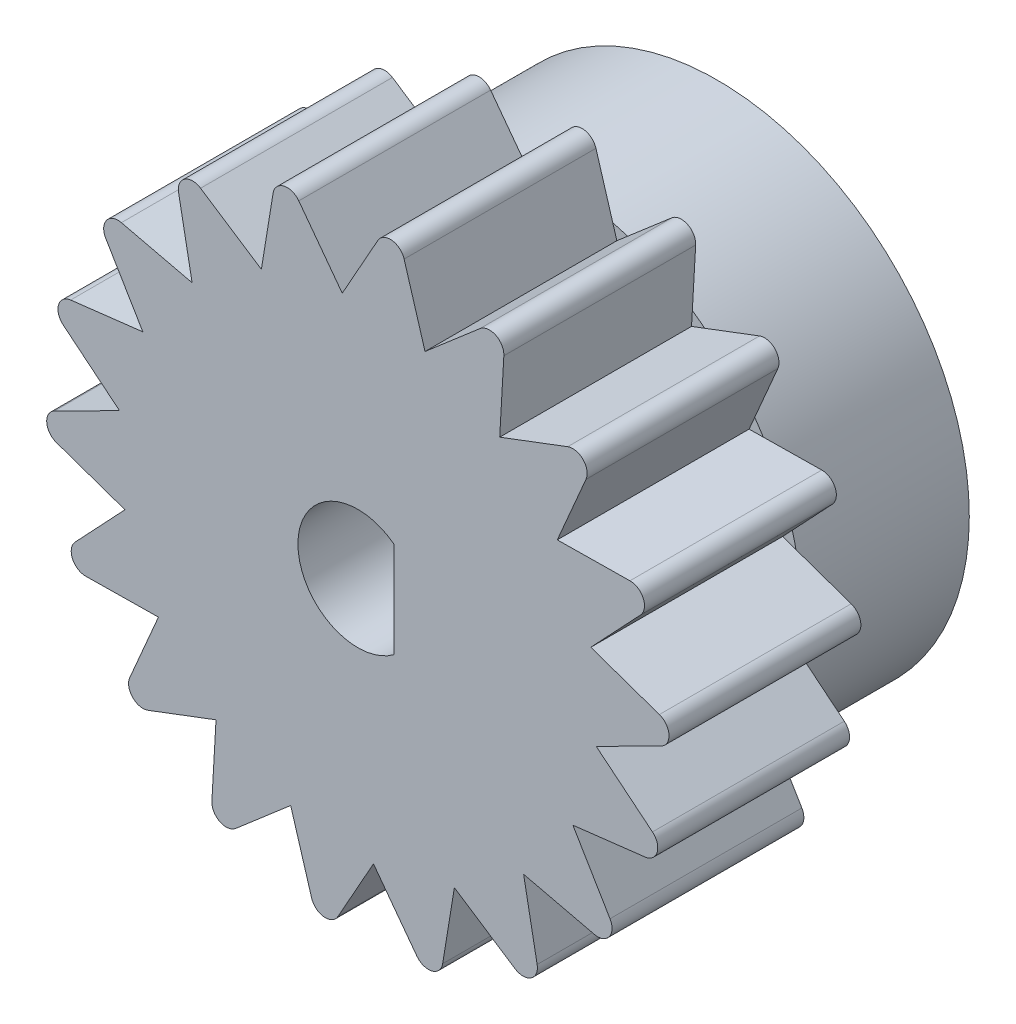
from build123d import *

# Parameters (mm, degrees)
SKETCH1_R                 = 7.5
BOSS_EXTRUDE1_DEPTH       = 10
SKETCH3_R                 = 10.5
BOSS_EXTRUDE2_DEPTH       = 5
CUT_EXTRUDE1_REACH        = 23.107
BOSS_EXTRUDE3_START       = -8
SKETCH4_R                 = 14.5
SKETCH4_R_2               = 7.5
BOSS_EXTRUDE3_DEPTH       = 8
BOSS_EXTRUDE4_OUTLINE_R   = 10.5
BOSS_EXTRUDE4_OUTLINE_R_2 = 7.5
BOSS_EXTRUDE4_DEPTH       = 2
SKETCH6_R                 = 14.465552515
CUT_EXTRUDE2_DEPTH        = 8


# Read off the part's stored shape, not the designer's step: Boss-Extrude4
with BuildPart() as part:
    # Sketch1 → Boss-Extrude1 (new body)
    with BuildSketch(Plane.XY):
        Circle(SKETCH1_R)
    extrude(amount=BOSS_EXTRUDE1_DEPTH)

    # Sketch3 → Boss-Extrude2 (add)
    with BuildSketch(Plane(origin=(0, 0, 0), x_dir=(-1, 0, 0), z_dir=(0, 0, -1))):
        Circle(SKETCH3_R)
    extrude(amount=BOSS_EXTRUDE2_DEPTH)

    # Sketch2 → Cut-Extrude1 (cut, up to next)
    with BuildSketch(Plane.XY.offset(10), mode=Mode.PRIVATE) as cut_extrude1_sk1:
        with BuildLine():
            Line((1.5, 2), (1.5, -2))
            ThreePointArc((1.5, -2), (-2.5, 0), (1.5, 2))
        make_face()
    cut_extrude1_tool1 = extrude(cut_extrude1_sk1.sketch, amount=-CUT_EXTRUDE1_REACH, mode=Mode.PRIVATE) & part.part
    add(cut_extrude1_tool1.solids().sort_by_distance((-0.316718, 0, 10))[0], mode=Mode.SUBTRACT)

    # Sketch4 → Boss-Extrude3 (add)
    with BuildSketch(Plane.XY.offset(10).offset(BOSS_EXTRUDE3_START)):
        Circle(SKETCH4_R)
        with Locations(Location((0, 0, 0), (0, 0, 180))):
            Circle(SKETCH4_R_2, mode=Mode.SUBTRACT)
    extrude(amount=BOSS_EXTRUDE3_DEPTH)

    # Boss-Extrude4 outline → Boss-Extrude4 (add)
    with BuildSketch(Plane.XY):
        Circle(BOSS_EXTRUDE4_OUTLINE_R)
        Circle(BOSS_EXTRUDE4_OUTLINE_R_2, mode=Mode.SUBTRACT)
    extrude(amount=BOSS_EXTRUDE4_DEPTH)

    # Sketch6 → Cut-Extrude2 (cut)
    with BuildSketch(Plane.XY.offset(10)):
        Circle(SKETCH6_R)
        with BuildLine():
            Line((5.915587052, 8.062619291), (6.088339002, 11.088366247))
            ThreePointArc((6.088339002, 11.088366247), (5.754853945, 11.660608595), (5.097799094, 11.57722688))
            Line((5.097799094, 11.57722688), (2.801255295, 9.599633783))
            Line((2.801255295, 9.599633783), (1.92872262, 12.501990517))
            ThreePointArc((1.92872262, 12.501990517), (1.419630763, 12.925663822), (0.830719394, 12.622584645))
            Line((0.830719394, 12.622584645), (-0.650949193, 9.978790766))
            Line((-0.650949193, 9.978790766), (-2.463526175, 12.407690221))
            ThreePointArc((-2.463526175, 12.407690221), (-3.086820841, 12.631693229), (-3.536557325, 12.145472413))
            Line((-3.536557325, 12.145472413), (-4.024639601, 9.154358311))
            Line((-4.024639601, 9.154358311), (-6.558637356, 10.816839366))
            ThreePointArc((-6.558637356, 10.816839366), (-7.220956294, 10.814154009), (-7.477273036, 10.203436959))
            Line((-7.477273036, 10.203436959), (-6.912899076, 7.225775139))
            Line((-6.912899076, 7.225775139), (-9.862680076, 7.921318044))
            ThreePointArc((-9.862680076, 7.921318044), (-10.484137849, 7.692268216), (-10.516119267, 7.030716422))
            Line((-10.516119267, 7.030716422), (-8.967360899, 4.425656845))
            Line((-8.967360899, 4.425656845), (-11.977138021, 4.07036886))
            ThreePointArc((-11.977138021, 4.07036886), (-12.48277765, 3.64258135), (-12.286566313, 3.009987721))
            Line((-12.286566313, 3.009987721), (-9.940226653, 1.09173902))
            Line((-9.940226653, 1.09173902), (-12.646976358, -0.271526881))
            ThreePointArc((-12.646976358, -0.271526881), (-12.97581024, -0.846454586), (-12.575072131, -1.373789921))
            Line((-12.575072131, -1.373789921), (-9.714154371, -2.373858644))
            Line((-9.714154371, -2.373858644), (-11.791402696, -4.580672473))
            ThreePointArc((-11.791402696, -4.580672473), (-11.903768612, -5.233395606), (-11.346838661, -5.591868224))
            Line((-11.346838661, -5.591868224), (-8.316411706, -5.553133921))
            Line((-8.316411706, -5.553133921), (-9.513611846, -8.337321361))
            ThreePointArc((-9.513611846, -8.337321361), (-9.395956809, -8.98911188), (-8.750008988, -9.135484692))
            Line((-8.750008988, -9.135484692), (-5.915587052, -8.062619291))
            Line((-5.915587052, -8.062619291), (-6.088339002, -11.088366247))
            ThreePointArc((-6.088339002, -11.088366247), (-5.754853945, -11.660608595), (-5.097799094, -11.57722688))
            Line((-5.097799094, -11.57722688), (-2.801255295, -9.599633783))
            Line((-2.801255295, -9.599633783), (-1.92872262, -12.501990517))
            ThreePointArc((-1.92872262, -12.501990517), (-1.419630763, -12.925663822), (-0.830719394, -12.622584645))
            Line((-0.830719394, -12.622584645), (0.650949193, -9.978790766))
            Line((0.650949193, -9.978790766), (2.463526175, -12.407690221))
            ThreePointArc((2.463526175, -12.407690221), (3.086820841, -12.631693229), (3.536557325, -12.145472413))
            Line((3.536557325, -12.145472413), (4.024639601, -9.154358311))
            Line((4.024639601, -9.154358311), (6.558637356, -10.816839366))
            ThreePointArc((6.558637356, -10.816839366), (7.220956294, -10.814154009), (7.477273036, -10.203436959))
            Line((7.477273036, -10.203436959), (6.912899076, -7.225775139))
            Line((6.912899076, -7.225775139), (9.862680076, -7.921318044))
            ThreePointArc((9.862680076, -7.921318044), (10.484137849, -7.692268216), (10.516119267, -7.030716422))
            Line((10.516119267, -7.030716422), (8.967360899, -4.425656845))
            Line((8.967360899, -4.425656845), (11.977138021, -4.07036886))
            ThreePointArc((11.977138021, -4.07036886), (12.48277765, -3.64258135), (12.286566313, -3.009987721))
            Line((12.286566313, -3.009987721), (9.940226653, -1.09173902))
            Line((9.940226653, -1.09173902), (12.646976358, 0.271526881))
            ThreePointArc((12.646976358, 0.271526881), (12.97581024, 0.846454586), (12.575072131, 1.373789921))
            Line((12.575072131, 1.373789921), (9.714154371, 2.373858644))
            Line((9.714154371, 2.373858644), (11.791402696, 4.580672473))
            ThreePointArc((11.791402696, 4.580672473), (11.903768612, 5.233395606), (11.346838661, 5.591868224))
            Line((11.346838661, 5.591868224), (8.316411706, 5.553133921))
            Line((8.316411706, 5.553133921), (9.513611846, 8.337321361))
            ThreePointArc((9.513611846, 8.337321361), (9.395956809, 8.98911188), (8.750008988, 9.135484692))
            Line((8.750008988, 9.135484692), (5.915587052, 8.062619291))
        make_face(mode=Mode.SUBTRACT)
    extrude(amount=-CUT_EXTRUDE2_DEPTH, mode=Mode.SUBTRACT)


with BuildPart() as body_2:
    # of the pieces the cut leaves, the one that is kept (cut_extrude2_keep)
    add(part.part.solids().sort_by_distance((-10.5, 0, 0))[0])


solid = body_2.part
